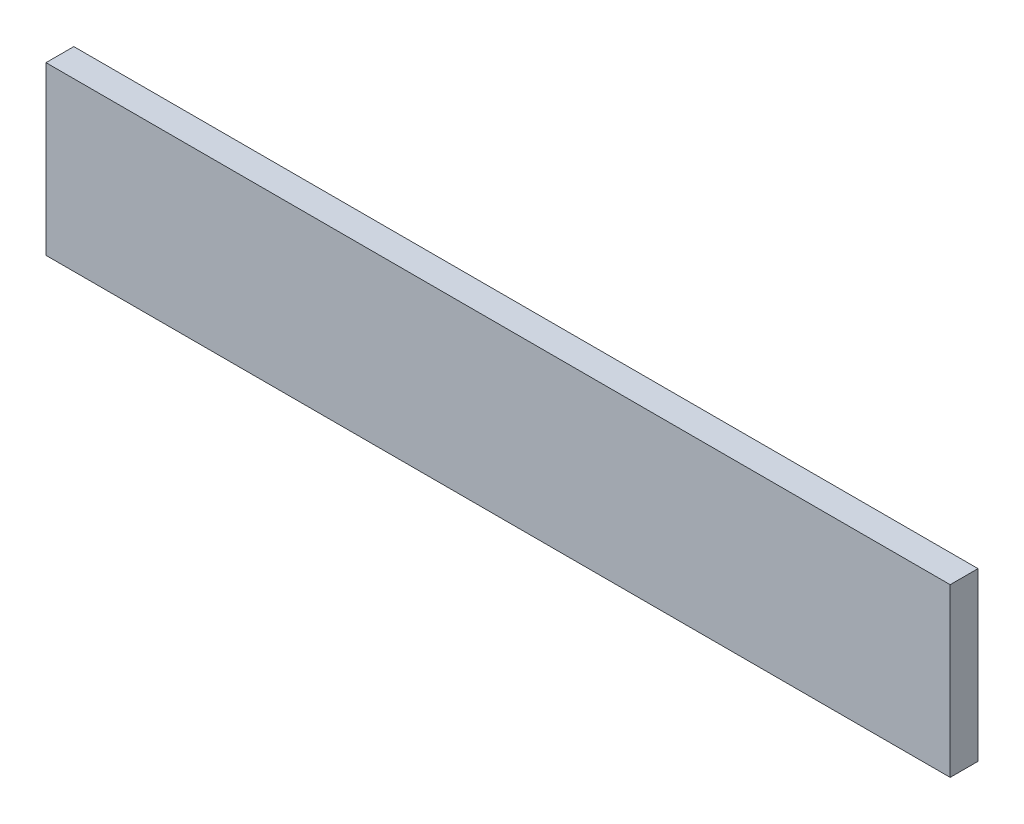
from build123d import *

# Parameters (mm, degrees)
SKETCH1_W           = 650
SKETCH1_H           = 120
BOSS_EXTRUDE1_DEPTH = 20


with BuildPart() as part:
    # Sketch1 → Boss-Extrude1 (new body)
    with BuildSketch(Plane.XY):
        with Locations((325, 60)):
            Rectangle(SKETCH1_W, SKETCH1_H)
    extrude(amount=BOSS_EXTRUDE1_DEPTH)


solid = part.part
